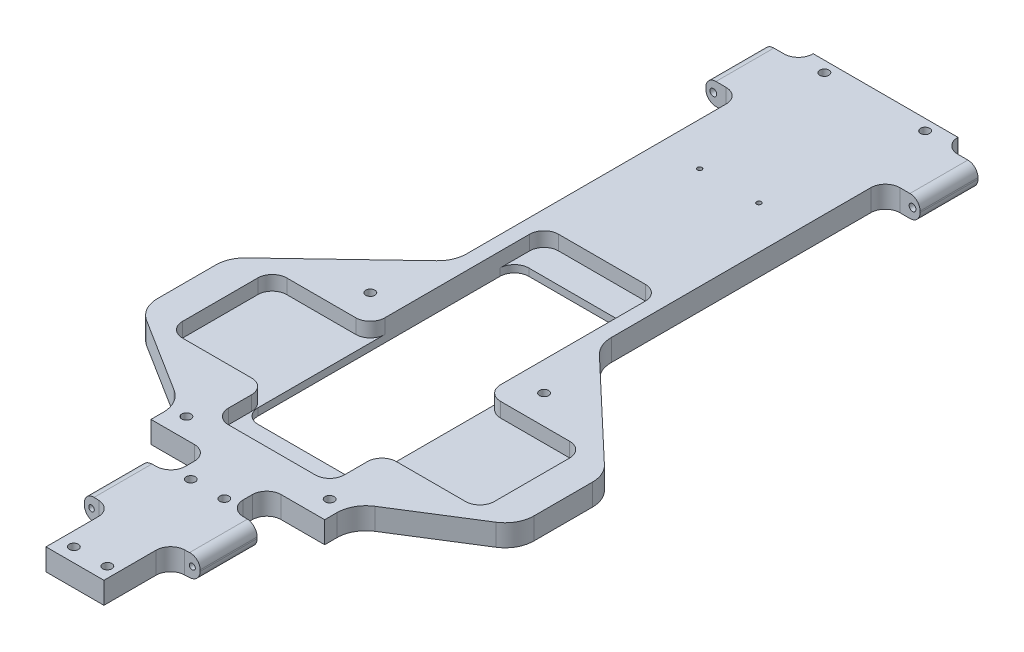
from build123d import *

# Parameters (mm, degrees)
CHASSIS_DEPTH        = 9.525
SKETCH4_W            = 50.8
SKETCH4_H            = 144.78
BATT_RECESS_DEPTH    = 6.35
SKETCH7_W            = 43
SKETCH7_H            = 45.72
ESC_RECESS_DEPTH     = 6.35
BODY_FILLETS_R       = 12.7
SKETCH8_W            = 50.8
SKETCH8_H            = 118.78
CUT_EXTRUDE1_DEPTH   = 366.055971736
SKETCH9_R            = 2
DIFF_HOLES_DEPTH     = 366.125
MALE_DEPTH           = 9.525
SKETCH11_R           = 1.27
CUT_EXTRUDE3_DEPTH   = 13.97
FILLET1_R            = 4.445
FILLET2_R            = 6.35
FILLET1_OF_MIRROR5_R = 4.445
BATTRECESSFILLET_R   = 6.35
INNER_FILLETS_R      = 6.35
SKETCH12_R           = 2.000000064
BATTERYMOUNT_DEPTH   = 366.125
SKETCH13_W           = 15.24
SKETCH13_H           = 25.4
MALE2_DEPTH          = 9.525
FILLET3_R            = 6.35
FILLET4_R            = 4.445
SKETCH14_R           = 1.495807557
CUT_EXTRUDE4_DEPTH   = 335.169144891
FILLET5_R            = 4.445
FILLET6_R            = 6.35
SKETCH16_R           = 2.000000064
CUT_EXTRUDE5_DEPTH   = 366.125
SKETCH17_R           = 2.000000064
CUT_EXTRUDE6_DEPTH   = 366.125
SKETCH15_R           = 1.016
CUT_EXTRUDE7_DEPTH   = 366.125
FILLET7_R            = 6.35
FILLET8_R            = 6.35


with BuildPart() as part:
    # Sketch2 → Chassis (new body)
    with BuildSketch(Plane(origin=(0, 0, 0), x_dir=(1, 0, 0), z_dir=(0, 1, 0))):
        Polygon((-82.55, 149.86), (-31.75, 198.063299051), (-31.75, 355.543299051), (31.75, 355.543299051), (31.75, 198.063299051), (82.55, 149.86), (82.55, 111.76), (38.1, 83.82), (38.1, 71.422057808), (12.7, 71.422057808), (12.7, 0), (0, 0), (-12.7, 0), (-12.7, 71.422057808), (-38.1, 71.422057808), (-38.1, 83.82), (-82.55, 111.76), align=None)
    extrude(amount=-CHASSIS_DEPTH)

    # Sketch4 → Batt Recess (cut)
    with BuildSketch(Plane(origin=(0, 0, 0), x_dir=(1, 0, 0), z_dir=(0, 1, 0))):
        with Locations((0, 158.75)):
            Rectangle(SKETCH4_W, SKETCH4_H)
    extrude(amount=-BATT_RECESS_DEPTH, mode=Mode.SUBTRACT)

    # Sketch7 → ESC Recess (cut)
    with BuildSketch(Plane(origin=(0, 0, 0), x_dir=(1, 0, 0), z_dir=(0, 1, 0))):
        with Locations((-46.9, 132.08)):
            Rectangle(SKETCH7_W, SKETCH7_H)
    esc_recess = extrude(amount=-ESC_RECESS_DEPTH, mode=Mode.SUBTRACT)

    # Mirror27: ESC Recess across plane
    add(esc_recess.mirror(Plane(origin=(0, 0, 0), x_dir=(0, 0, 1), z_dir=(1, 0, 0))), mode=Mode.SUBTRACT)

    # Body Fillets
    body_fillets_edges = [part.edges().sort_by_distance(p)[0] for p in [
        (-38.1, -4.7625, -83.82),
        (-82.55, -4.7625, -111.76),
        (-82.55, -4.7625, -149.86),
        (-31.75, -4.7625, -198.063299051),
        (31.75, -4.7625, -198.063299051),
        (82.55, -4.7625, -149.86),
        (82.55, -4.7625, -111.76),
        (38.1, -4.7625, -83.82),
    ]]
    fillet(body_fillets_edges, radius=BODY_FILLETS_R)

    # Sketch8 → Cut-Extrude1 (cut, through all)
    with BuildSketch(Plane(origin=(0, -6.35, 0), x_dir=(1, 0, 0), z_dir=(0, 1, 0))):
        with Locations((0, 158.75)):
            Rectangle(SKETCH8_W, SKETCH8_H)
    extrude(amount=-CUT_EXTRUDE1_DEPTH, mode=Mode.SUBTRACT)

    # Sketch9 → Diff Holes (cut, through all)
    with BuildSketch(Plane(origin=(0, 0, 0), x_dir=(1, 0, 0), z_dir=(0, 1, 0))):
        with Locations(Location((-6.6, 6.1, 0), (0, 0, 270))):
            Circle(SKETCH9_R)
        with Locations(Location((8.1, 6.1, 0), (0, 0, 270))):
            Circle(SKETCH9_R)
        with Locations(Location((-6.6, 57.4, 0), (0, 0, 270))):
            Circle(SKETCH9_R)
        with Locations(Location((8.1, 57.4, 0), (0, 0, 270))):
            Circle(SKETCH9_R)
    extrude(amount=-DIFF_HOLES_DEPTH, mode=Mode.SUBTRACT)

    # Sketch10 → Male (add)
    with BuildSketch(Plane(origin=(0, 0, 0), x_dir=(1, 0, 0), z_dir=(0, 1, 0))):
        Polygon((-12.7, 55.006119234), (-25.4, 54.498104125), (-25.4, 29.501895875), (-12.7, 28.993880766), align=None)
    male = extrude(amount=-MALE_DEPTH)

    # Sketch11 → Cut-Extrude3 (cut, symmetric)
    with BuildSketch(Plane.XY.offset(-42)):
        with Locations((-22.098, -4.7625)):
            Circle(SKETCH11_R)
    cut_extrude3 = extrude(amount=CUT_EXTRUDE3_DEPTH, both=True, mode=Mode.SUBTRACT)

    # Fillet1
    fillet1_edges = [part.edges().sort_by_distance(p)[0] for p in [
        (-25.4, 0, -42),
        (-25.4, -9.525, -42),
    ]]
    fillet(fillet1_edges, radius=FILLET1_R)

    # Fillet2
    fillet2_edges = [part.edges().sort_by_distance(p)[0] for p in [
        (-12.7, -4.7625, -28.993880766),
        (-12.7, -4.7625, -55.006119234),
    ]]
    fillet(fillet2_edges, radius=FILLET2_R)

    # Mirror5: Male, Cut-Extrude3 across plane
    add(male.mirror(Plane(origin=(0, 0, 0), x_dir=(0, 0, 1), z_dir=(1, 0, 0))))
    add(cut_extrude3.mirror(Plane(origin=(0, 0, 0), x_dir=(0, 0, 1), z_dir=(1, 0, 0))), mode=Mode.SUBTRACT)

    # Fillet1 of Mirror5
    fillet1_of_mirror5_edges = [part.edges().sort_by_distance(p)[0] for p in [
        (25.4, 0, -42),
        (25.4, -9.525, -42),
    ]]
    fillet(fillet1_of_mirror5_edges, radius=FILLET1_OF_MIRROR5_R)

    # BattRecessFillet
    battrecessfillet_edges = [part.edges().sort_by_distance(p)[0] for p in [
        (-25.4, -7.9375, -99.36),
        (25.4, -7.9375, -99.36),
        (25.4, -7.9375, -218.14),
        (-25.4, -7.9375, -218.14),
    ]]
    fillet(battrecessfillet_edges, radius=BATTRECESSFILLET_R)

    # Inner Fillets
    # the kernel refuses this fillet: 6.35 mm, written as the material it adds along each edge
    with BuildSketch(Plane(origin=(25.4, 0, -231.14), x_dir=(0, 0, 1), z_dir=(0, -1, 0))) as inner_fillets_piece_1_section:
        with BuildLine():
            CenterArc((INNER_FILLETS_R, INNER_FILLETS_R), INNER_FILLETS_R, 180, 90)
            Line((0, INNER_FILLETS_R), (0, 0))
            Line((0, 0), (INNER_FILLETS_R, 0))
        make_face()
    inner_fillets_piece_1 = extrude(amount=22.225, mode=Mode.PRIVATE)
    inner_fillets_piece_1 = split(inner_fillets_piece_1, bisect_by=Plane(origin=(23.981613588, -9.525, -229.721613588), z_dir=(0, 1, 0)), keep=Keep.TOP, mode=Mode.PRIVATE)
    add(inner_fillets_piece_1)
    with BuildSketch(Plane(origin=(-25.4, 0, -231.14), x_dir=(0, 0, 1), z_dir=(0, -1, 0))) as inner_fillets_piece_2_section:
        with BuildLine():
            CenterArc((INNER_FILLETS_R, -INNER_FILLETS_R), INNER_FILLETS_R, 90, 90)
            Line((0, -INNER_FILLETS_R), (0, 0))
            Line((0, 0), (INNER_FILLETS_R, 0))
        make_face()
    inner_fillets_piece_2 = extrude(amount=22.225, mode=Mode.PRIVATE)
    inner_fillets_piece_2 = split(inner_fillets_piece_2, bisect_by=Plane(origin=(-23.981613588, -9.525, -229.721613588), z_dir=(0, 1, 0)), keep=Keep.TOP, mode=Mode.PRIVATE)
    add(inner_fillets_piece_2)
    with BuildSketch(Plane(origin=(-68.4, 0, -154.94), x_dir=(0, 0, 1), z_dir=(0, -1, 0))) as inner_fillets_piece_3_section:
        with BuildLine():
            CenterArc((INNER_FILLETS_R, -INNER_FILLETS_R), INNER_FILLETS_R, 90, 90)
            Line((0, -INNER_FILLETS_R), (0, 0))
            Line((0, 0), (INNER_FILLETS_R, 0))
        make_face()
    inner_fillets_piece_3 = extrude(amount=22.225, mode=Mode.PRIVATE)
    inner_fillets_piece_3 = split(inner_fillets_piece_3, bisect_by=Plane(origin=(-66.981613588, -9.525, -153.521613588), z_dir=(0, 1, 0)), keep=Keep.TOP, mode=Mode.PRIVATE)
    add(inner_fillets_piece_3)
    with BuildSketch(Plane(origin=(25.4, 0, -86.36), x_dir=(0, 0, -1), z_dir=(0, -1, 0))) as inner_fillets_piece_4_section:
        with BuildLine():
            CenterArc((INNER_FILLETS_R, -INNER_FILLETS_R), INNER_FILLETS_R, 90, 90)
            Line((0, -INNER_FILLETS_R), (0, 0))
            Line((0, 0), (INNER_FILLETS_R, 0))
        make_face()
    inner_fillets_piece_4 = extrude(amount=22.225, mode=Mode.PRIVATE)
    inner_fillets_piece_4 = split(inner_fillets_piece_4, bisect_by=Plane(origin=(23.981613588, -9.525, -87.778386412), z_dir=(0, 1, 0)), keep=Keep.TOP, mode=Mode.PRIVATE)
    add(inner_fillets_piece_4)
    with BuildSketch(Plane(origin=(-25.4, 0, -86.36), x_dir=(0, 0, -1), z_dir=(0, -1, 0))) as inner_fillets_piece_5_section:
        with BuildLine():
            CenterArc((INNER_FILLETS_R, INNER_FILLETS_R), INNER_FILLETS_R, 180, 90)
            Line((0, INNER_FILLETS_R), (0, 0))
            Line((0, 0), (INNER_FILLETS_R, 0))
        make_face()
    inner_fillets_piece_5 = extrude(amount=22.225, mode=Mode.PRIVATE)
    inner_fillets_piece_5 = split(inner_fillets_piece_5, bisect_by=Plane(origin=(-23.981613588, -9.525, -87.778386412), z_dir=(0, 1, 0)), keep=Keep.TOP, mode=Mode.PRIVATE)
    add(inner_fillets_piece_5)
    with BuildSketch(Plane(origin=(-68.4, 0, -109.22), x_dir=(1, 0, 0), z_dir=(0, -1, 0))) as inner_fillets_piece_6_section:
        with BuildLine():
            CenterArc((INNER_FILLETS_R, -INNER_FILLETS_R), INNER_FILLETS_R, 90, 90)
            Line((0, -INNER_FILLETS_R), (0, 0))
            Line((0, 0), (INNER_FILLETS_R, 0))
        make_face()
    inner_fillets_piece_6 = extrude(amount=22.225, mode=Mode.PRIVATE)
    inner_fillets_piece_6 = split(inner_fillets_piece_6, bisect_by=Plane(origin=(-66.981613588, -9.525, -110.638386412), z_dir=(0, 1, 0)), keep=Keep.TOP, mode=Mode.PRIVATE)
    add(inner_fillets_piece_6)
    with BuildSketch(Plane(origin=(68.4, 0, -154.94), x_dir=(-1, 0, 0), z_dir=(0, -1, 0))) as inner_fillets_piece_7_section:
        with BuildLine():
            CenterArc((INNER_FILLETS_R, -INNER_FILLETS_R), INNER_FILLETS_R, 90, 90)
            Line((0, -INNER_FILLETS_R), (0, 0))
            Line((0, 0), (INNER_FILLETS_R, 0))
        make_face()
    inner_fillets_piece_7 = extrude(amount=22.225, mode=Mode.PRIVATE)
    inner_fillets_piece_7 = split(inner_fillets_piece_7, bisect_by=Plane(origin=(66.981613588, -9.525, -153.521613588), z_dir=(0, 1, 0)), keep=Keep.TOP, mode=Mode.PRIVATE)
    add(inner_fillets_piece_7)
    with BuildSketch(Plane(origin=(68.4, 0, -109.22), x_dir=(0, 0, -1), z_dir=(0, -1, 0))) as inner_fillets_piece_8_section:
        with BuildLine():
            CenterArc((INNER_FILLETS_R, -INNER_FILLETS_R), INNER_FILLETS_R, 90, 90)
            Line((0, -INNER_FILLETS_R), (0, 0))
            Line((0, 0), (INNER_FILLETS_R, 0))
        make_face()
    inner_fillets_piece_8 = extrude(amount=22.225, mode=Mode.PRIVATE)
    inner_fillets_piece_8 = split(inner_fillets_piece_8, bisect_by=Plane(origin=(66.981613588, -9.525, -110.638386412), z_dir=(0, 1, 0)), keep=Keep.TOP, mode=Mode.PRIVATE)
    add(inner_fillets_piece_8)
    # the kernel refuses this fillet: 6.35 mm, written as the material it takes off along each edge
    with BuildSketch(Plane(origin=(-25.4, 15.875, -154.94), x_dir=(0, 0, -1), z_dir=(0, -1, 0)), Plane(origin=(25.4, 15.875, -109.22), x_dir=(0, 0, 1), z_dir=(0, -1, 0))) as inner_fillets_2_piece_1:
        with BuildLine():
            CenterArc((INNER_FILLETS_R, -INNER_FILLETS_R), INNER_FILLETS_R, 90, 90)
            Line((0, -INNER_FILLETS_R), (0, 0))
            Line((0, 0), (INNER_FILLETS_R, 0))
        make_face()
    extrude(amount=22.225, mode=Mode.SUBTRACT)
    with BuildSketch(Plane(origin=(-25.4, 15.875, -109.22), x_dir=(0, 0, 1), z_dir=(0, -1, 0)), Plane(origin=(25.4, 15.875, -154.94), x_dir=(0, 0, -1), z_dir=(0, -1, 0))) as inner_fillets_2_piece_2:
        with BuildLine():
            CenterArc((INNER_FILLETS_R, INNER_FILLETS_R), INNER_FILLETS_R, 180, 90)
            Line((0, INNER_FILLETS_R), (0, 0))
            Line((0, 0), (INNER_FILLETS_R, 0))
        make_face()
    extrude(amount=22.225, mode=Mode.SUBTRACT)

    # Sketch12 → BatteryMount (cut, through all)
    with BuildSketch(Plane(origin=(0, 0, 0), x_dir=(1, 0, 0), z_dir=(0, 1, 0))):
        with Locations(Location((-38.1, 167.64, 0), (0, 0, 270))):
            Circle(SKETCH12_R)
    batterymount = extrude(amount=-BATTERYMOUNT_DEPTH, mode=Mode.SUBTRACT)

    # Mirror6: BatteryMount across plane
    add(batterymount.mirror(Plane(origin=(0, 0, 0), x_dir=(0, 0, 1), z_dir=(1, 0, 0))), mode=Mode.SUBTRACT)

    # Sketch13 → Male2 (add)
    with BuildSketch(Plane(origin=(0, 0, 0), x_dir=(1, 0, 0), z_dir=(0, 1, 0))):
        with Locations((-39.37, 336.372348637)):
            Rectangle(SKETCH13_W, SKETCH13_H)
    male2 = extrude(amount=-MALE2_DEPTH)

    # Fillet3
    fillet3_edges = [part.edges().sort_by_distance(p)[0] for p in [
        (-31.75, -4.7625, -323.672348637),
        (-31.75, -4.7625, -349.072348637),
    ]]
    fillet(fillet3_edges, radius=FILLET3_R)

    # Fillet4
    fillet4_edges = [part.edges().sort_by_distance(p)[0] for p in [
        (-46.99, 0, -336.372348637),
        (-46.99, -9.525, -336.372348637),
    ]]
    fillet(fillet4_edges, radius=FILLET4_R)

    # Sketch14 → Cut-Extrude4 (cut, through all)
    with BuildSketch(Plane.XY.offset(-323.672348637)):
        with Locations((-43.688, -4.7625)):
            Circle(SKETCH14_R)
    cut_extrude4 = extrude(amount=-CUT_EXTRUDE4_DEPTH, mode=Mode.SUBTRACT)

    # Mirror13: Male2 across plane
    add(male2.mirror(Plane(origin=(0, 0, 0), x_dir=(0, 0, 1), z_dir=(1, 0, 0))))

    # Fillet5
    fillet5_edges = [part.edges().sort_by_distance(p)[0] for p in [
        (46.99, 0, -336.372348637),
        (46.99, -9.525, -336.372348637),
    ]]
    fillet(fillet5_edges, radius=FILLET5_R)

    # Fillet6
    fillet6_edges = [part.edges().sort_by_distance(p)[0] for p in [
        (31.75, -4.7625, -323.672348637),
        (31.75, -4.7625, -349.072348637),
    ]]
    fillet(fillet6_edges, radius=FILLET6_R)

    # Mirror21: Cut-Extrude4 across plane
    add(cut_extrude4.mirror(Plane(origin=(0, 0, 0), x_dir=(0, 0, 1), z_dir=(1, 0, 0))), mode=Mode.SUBTRACT)

    # Sketch16 → Cut-Extrude5 (cut, through all)
    with BuildSketch(Plane(origin=(0, 0, 0), x_dir=(1, 0, 0), z_dir=(0, 1, 0))):
        with Locations(Location((31.410975272, 80.293294067, 0), (0, 0, 270))):
            Circle(SKETCH16_R)
    cut_extrude5 = extrude(amount=-CUT_EXTRUDE5_DEPTH, mode=Mode.SUBTRACT)

    # Mirror22: Cut-Extrude5 across plane
    add(cut_extrude5.mirror(Plane(origin=(0, 0, 0), x_dir=(0, 0, 1), z_dir=(1, 0, 0))), mode=Mode.SUBTRACT)

    # Sketch17 → Cut-Extrude6 (cut, through all)
    with BuildSketch(Plane(origin=(0, 0, 0), x_dir=(1, 0, 0), z_dir=(0, 1, 0))):
        with Locations(Location((-22.098, 350.780799051, 0), (0, 0, 270))):
            Circle(SKETCH17_R)
    cut_extrude6 = extrude(amount=-CUT_EXTRUDE6_DEPTH, mode=Mode.SUBTRACT)

    # Mirror23: Cut-Extrude6 across plane
    add(cut_extrude6.mirror(Plane(origin=(0, 0, 0), x_dir=(0, 0, 1), z_dir=(1, 0, 0))), mode=Mode.SUBTRACT)

    # Sketch15 → Cut-Extrude7 (cut, through all)
    with BuildSketch(Plane(origin=(0, 0, 0), x_dir=(1, 0, 0), z_dir=(0, 1, 0))):
        with Locations(Location((-13, 286.963299051, 0), (0, 0, 270))):
            Circle(SKETCH15_R)
        with Locations(Location((13, 286.963299051, 0), (0, 0, 270))):
            Circle(SKETCH15_R)
    extrude(amount=-CUT_EXTRUDE7_DEPTH, mode=Mode.SUBTRACT)

    # Fillet7
    fillet7_edges = [part.edges().sort_by_distance(p)[0] for p in [
        (12.7, -4.7625, -28.993880766),
        (12.7, -4.7625, -55.006119234),
    ]]
    fillet(fillet7_edges, radius=FILLET7_R)

    # Fillet8
    fillet8_edges = [part.edges().sort_by_distance(p)[0] for p in [
        (12.7, -4.7625, -71.422057808),
        (-12.7, -4.7625, -71.422057808),
    ]]
    fillet(fillet8_edges, radius=FILLET8_R)


solid = part.part
